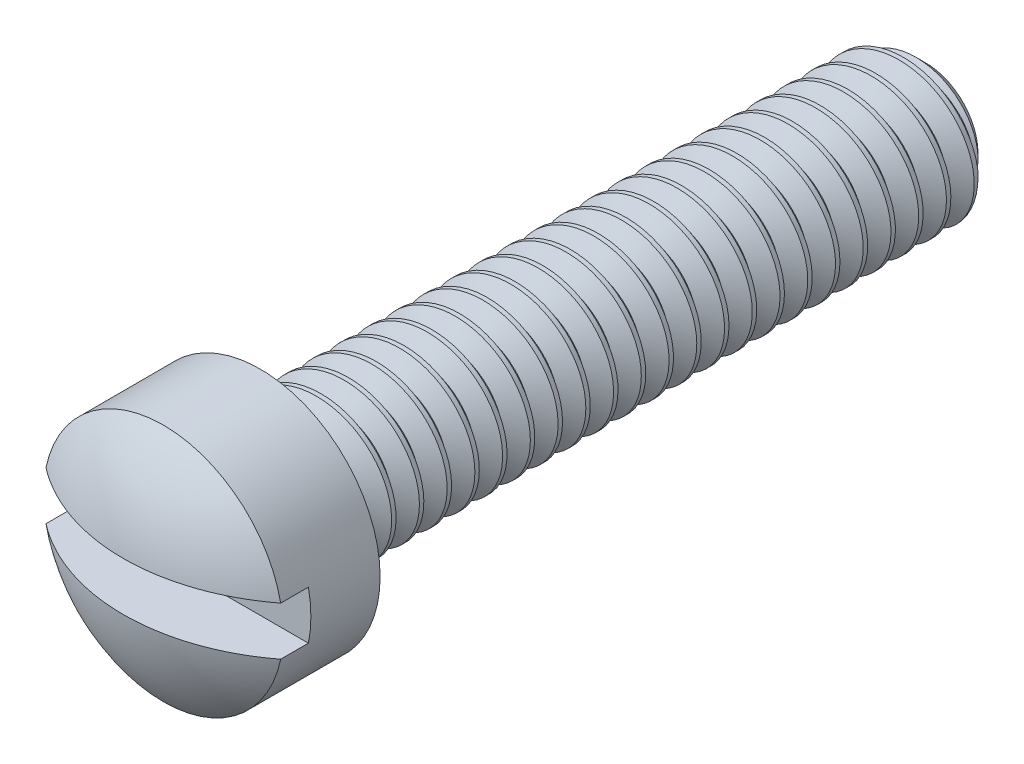
from build123d import *

# Parameters (mm, degrees)
SKETCH1_R        = 3.429
EXTRUDE3_DEPTH   = 3.9624
SKETCH4_W        = 19.05
SKETCH4_H        = 2.0828
CHAMFER2_SIZE    = 0.5953125
CUT_SWEEP1_PITCH = 0.79375
SKETCH26_R       = 0.5461
EXTRUDE13_DEPTH  = 3.935418826
SKETCH31_W       = 6.858
SKETCH31_H       = 1.3890625
EXTRUDE15_DEPTH  = 1.9812


with BuildPart() as part:
    # Sketch1 → Extrude3 (new body)
    with BuildSketch(Plane.XY):
        Circle(SKETCH1_R)
    extrude(amount=EXTRUDE3_DEPTH)

    # Sketch11 → Cut-Revolve3 (revolve, cut)
    with BuildSketch(Plane(origin=(0, 0, 0), x_dir=(0, 0, -1), z_dir=(1, 0, 0))):
        with BuildLine():
            Line((-4.2164, 3.56616), (0, 3.56616))
            Line((0, 3.56616), (0, 3.429))
            Line((0, 3.429), (-2.77368, 3.429))
            ThreePointArc((-2.77368, 3.429), (-3.656790715, 1.814600248), (-3.9624, 0))
            Line((-3.9624, 0), (-4.2164, 0))
            Line((-4.2164, 0), (-4.2164, 3.56616))
        make_face()
    revolve(axis=Axis((0, 0, 0), (0, 0, 1)), mode=Mode.SUBTRACT)

    # Sketch26 → Extrude13 (add)
    with BuildSketch(Plane.XY):
        Circle(SKETCH26_R)
    extrude(amount=EXTRUDE13_DEPTH)

    # Sketch31 → Extrude15 (cut)
    with BuildSketch(Plane.XY.offset(3.9624)):
        Rectangle(SKETCH31_W, SKETCH31_H)
    extrude(amount=-EXTRUDE15_DEPTH, mode=Mode.SUBTRACT)


with BuildPart() as body_2:
    # Sketch4 → Revolve1 (revolve)
    with BuildSketch(Plane(origin=(0, 0, 0), x_dir=(0, 0, -1), z_dir=(1, 0, 0)), mode=Mode.PRIVATE) as revolve1_sk:
        with Locations((9.525, 1.0414)):
            Rectangle(SKETCH4_W, SKETCH4_H)
    revolve(revolve1_sk.sketch.rotate(Axis((0, 0, 0), (0, 0, -1)), 90), axis=Axis((0, 0, 0), (0, 0, -1)))

    # Chamfer2
    chamfer2_edges = [body_2.edges().sort_by_distance(p)[0] for p in [
        (-2.0828, 0, -19.05),
    ]]
    chamfer(chamfer2_edges, length=CHAMFER2_SIZE)

    # Cut-Sweep1: the profile of Sketch14 screwed along a right-hand helix of 28.992 turns, 8 arcs to a turn; built about Z, then put on its axis
    cut_sweep1_z = Axis((0, 0, 0), (0, 0, 1))
    cut_sweep1_corners = [(0, 2.107604687, 0), (0, 2.107604687, -0.69453125), (0, 1.570618598, -0.396875), (0, 1.570618598, -0.29765625)]
    with BuildLine(mode=Mode.PRIVATE) as cut_sweep1_profile:
        Line(cut_sweep1_corners[0], cut_sweep1_corners[1])
        Line(cut_sweep1_corners[1], cut_sweep1_corners[2])
        Line(cut_sweep1_corners[2], cut_sweep1_corners[3])
        Line(cut_sweep1_corners[3], cut_sweep1_corners[0])
    cut_sweep1_cap = Face(cut_sweep1_profile.wire())
    cut_sweep1_turn_angles = [0, 22.5, 45, 67.5, 90, 112.5, 135, 157.5, 180, 202.5, 225, 247.5, 270, 292.5, 315, 337.5, 360]
    cut_sweep1_turn_weights = [1, 0.9238795325112867, 1, 0.9238795325112867, 1, 0.9238795325112867, 1, 0.9238795325112867, 1, 0.9238795325112867, 1, 0.9238795325112867, 1, 0.9238795325112867, 1, 0.9238795325112867, 1]
    cut_sweep1_turn_rails = [Edge.make_bspline([Vector(p[0], p[1], 0).rotate(cut_sweep1_z, cut_sweep1_turn_angles[k]) / cut_sweep1_turn_weights[k] + Vector(0, 0, p[2] + CUT_SWEEP1_PITCH * cut_sweep1_turn_angles[k] / 360) for k in range(17)], [0, 0, 0, 1, 1, 2, 2, 3, 3, 4, 4, 5, 5, 6, 6, 7, 7, 8, 8, 8], 2, cut_sweep1_turn_weights) for p in cut_sweep1_corners]
    cut_sweep1_turn_sides = [Face.make_surface_from_curves(cut_sweep1_turn_rails[p[0]], cut_sweep1_turn_rails[p[1]]) for p in [(0, 1), (1, 2), (2, 3), (3, 0)]]
    cut_sweep1_last_angles = [10080, 10102.5, 10125, 10147.5, 10170, 10192.5, 10215, 10237.5, 10260, 10282.5, 10305, 10327.5, 10350, 10372.5, 10395, 10416.06, 10437.12]
    cut_sweep1_last_weights = [1, 0.9238795325112867, 1, 0.9238795325112867, 1, 0.9238795325112867, 1, 0.9238795325112867, 1, 0.9238795325112867, 1, 0.9238795325112867, 1, 0.9238795325112867, 1, 0.9332046326337592, 1]
    cut_sweep1_last_rails = [Edge.make_bspline([Vector(p[0], p[1], 0).rotate(cut_sweep1_z, cut_sweep1_last_angles[k]) / cut_sweep1_last_weights[k] + Vector(0, 0, p[2] + CUT_SWEEP1_PITCH * cut_sweep1_last_angles[k] / 360) for k in range(17)], [0, 0, 0, 1, 1, 2, 2, 3, 3, 4, 4, 5, 5, 6, 6, 7, 7, 8, 8, 8], 2, cut_sweep1_last_weights) for p in cut_sweep1_corners]
    cut_sweep1_last_sides = [Face.make_surface_from_curves(cut_sweep1_last_rails[p[0]], cut_sweep1_last_rails[p[1]]) for p in [(0, 1), (1, 2), (2, 3), (3, 0)]]
    cut_sweep1 = Plane(origin=(0, 0, -19.05), x_dir=(1, 0, 0), z_dir=(0, 0, 1)) * Solid(Shell([*[p.moved(Location((0, 0, CUT_SWEEP1_PITCH * i))) for i in range(28) for p in cut_sweep1_turn_sides], *cut_sweep1_last_sides, cut_sweep1_cap, cut_sweep1_cap.rotate(cut_sweep1_z, 10437.12).moved(Location((0, 0, CUT_SWEEP1_PITCH * 10437.12 / 360)))]))
    add(cut_sweep1, mode=Mode.SUBTRACT)


solid = Compound([part.part, body_2.part])
